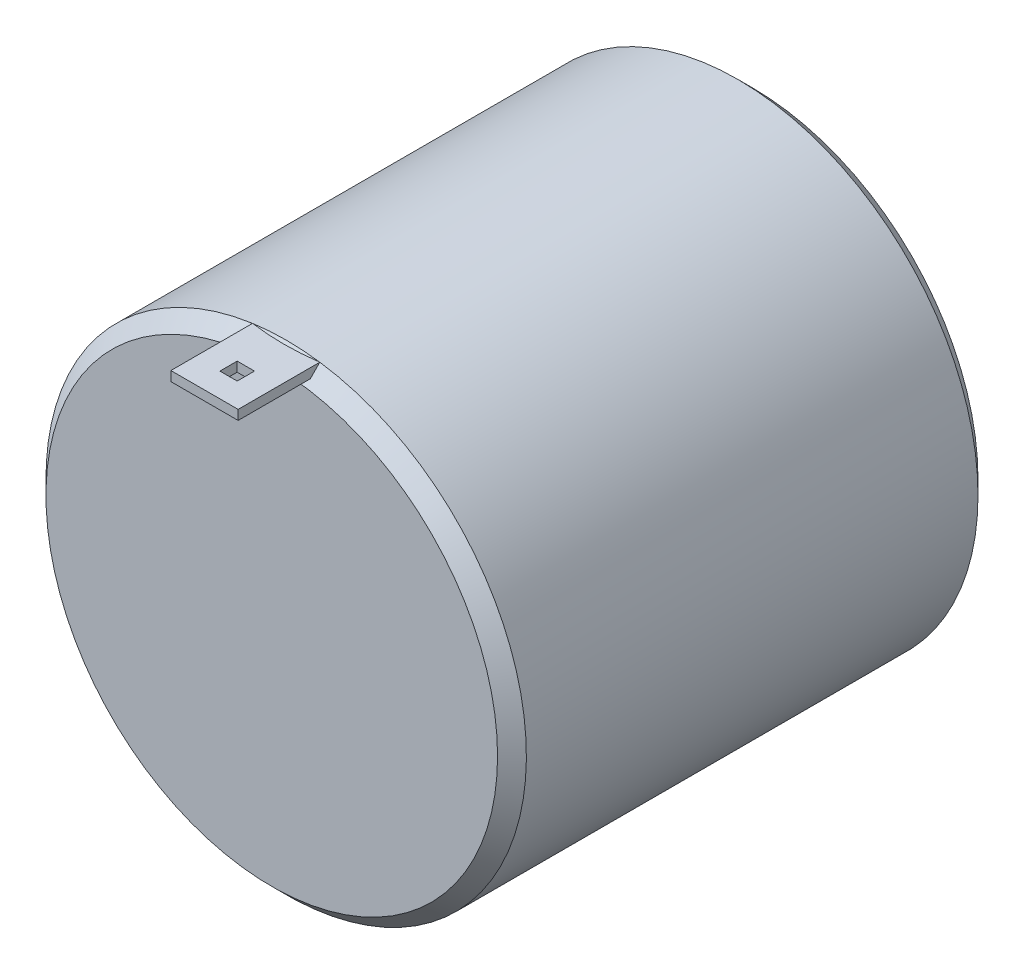
from build123d import *

# Parameters (mm, degrees)
SKETCH1_R                = 25
BOSS_EXTRUDE1_DEPTH      = 50
CHAMFER1_SIZE            = 1.5
BOSS_EXTRUDE2_DEPTH      = 7
BOSS_EXTRUDE2_DEPTH_BACK = 10
SKETCH2_W                = 7
SKETCH2_H                = 1
SKETCH3_W                = 1.8
SKETCH3_H                = 1.8
CUT_EXTRUDE1_DEPTH       = 7


with BuildPart() as part:
    # Sketch1 → Boss-Extrude1 (new body)
    with BuildSketch(Plane.XY):
        with Locations((25, 25)):
            Circle(SKETCH1_R)
    extrude(amount=BOSS_EXTRUDE1_DEPTH)

    # Chamfer1
    chamfer1_edges = [part.edges().sort_by_distance(p)[0] for p in [
        (0, 25, 0),
        (0, 25, 50),
    ]]
    chamfer(chamfer1_edges, length=CHAMFER1_SIZE)

    # Sketch2 → Boss-Extrude2 (add, two sides: drawn at the far end of the back side and taken through both)
    with BuildSketch(Plane.XY.offset(50).offset(-BOSS_EXTRUDE2_DEPTH_BACK)):
        with Locations((25, 49.253787589)):
            Rectangle(SKETCH2_W, SKETCH2_H)
    extrude(amount=BOSS_EXTRUDE2_DEPTH + BOSS_EXTRUDE2_DEPTH_BACK)

    # Sketch3 → Cut-Extrude1 (cut)
    with BuildSketch(Plane.XZ.offset(-48.753787589)):
        with Locations((25, 53.6)):
            Rectangle(SKETCH3_W, SKETCH3_H)
    extrude(amount=-CUT_EXTRUDE1_DEPTH, mode=Mode.SUBTRACT)


solid = part.part
